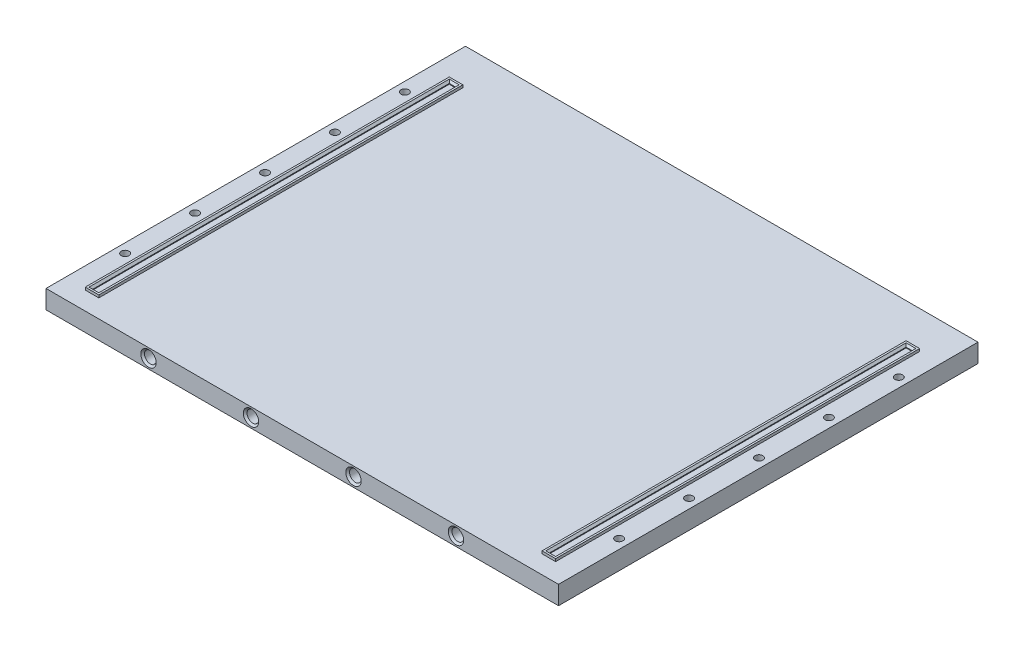
from build123d import *

# Parameters (mm, degrees)
SKETCH_1_W             = 138.06
SKETCH_1_H             = 113
EXTRUDE_301_DEPTH      = 5
SKETCH_2_W             = 3.65
SKETCH_2_H             = 98.05
SKETCH_2_W_2           = 1.65
SKETCH_2_H_2           = 96.05
EXTRUDE_2092_DEPTH     = 0.7
CHAMFER_2147_SIZE      = 0.5
CHAMFER_2335_SIZE      = 0.5
SKETCH_3_R             = 1.575
CUT_EXTRUDE_2766_DEPTH = 4.2
CUT_EXTRUDE_3301_REACH = 91.386
SKETCH_4_R             = 1.05
SKETCH_5_R             = 2
CUT_EXTRUDE_3811_DEPTH = 3
CHAMFER_3856_SIZE      = 0.5


with BuildPart() as part:
    # Эскиз1 → Extrude 301 (new body)
    with BuildSketch(Plane(origin=(0, 0, 0), x_dir=(1, 0, 0), z_dir=(0, 1, 0))):
        Rectangle(SKETCH_1_W, SKETCH_1_H)
    extrude(amount=EXTRUDE_301_DEPTH)

    # Эскиз2 → Extrude 2092 (add)
    # profile 1 of 2: a face of its own
    with BuildSketch(Plane(origin=(0, 5, 0), x_dir=(1, 0, 0), z_dir=(0, 1, 0))):
        with Locations((-61.525, -2.575)):
            Rectangle(SKETCH_2_W, SKETCH_2_H)
        with Locations((-61.525, -2.575)):
            Rectangle(SKETCH_2_W_2, SKETCH_2_H_2, mode=Mode.SUBTRACT)
    # profile 2 of 2: a face of its own
    with BuildSketch(Plane(origin=(0, 5, 0), x_dir=(1, 0, 0), z_dir=(0, 1, 0))):
        with Locations((61.525, -2.575)):
            Rectangle(SKETCH_2_W, SKETCH_2_H)
        with Locations((61.525, -2.575)):
            Rectangle(SKETCH_2_W_2, SKETCH_2_H_2, mode=Mode.SUBTRACT)
    extrude(amount=EXTRUDE_2092_DEPTH)

    # Chamfer 2147
    chamfer_2147_edges = [part.edges().sort_by_distance(p)[0] for p in [
        (-61.525, 5.7, -45.45),
        (-60.7, 5.7, 2.575),
        (-61.525, 5.7, 50.6),
        (-62.35, 5.7, 2.575),
    ]]
    chamfer(chamfer_2147_edges, length=CHAMFER_2147_SIZE)

    # Chamfer 2335
    chamfer_2335_edges = [part.edges().sort_by_distance(p)[0] for p in [
        (61.525, 5.7, 50.6),
        (60.7, 5.7, 2.575),
        (61.525, 5.7, -45.45),
        (62.35, 5.7, 2.575),
    ]]
    chamfer(chamfer_2335_edges, length=CHAMFER_2335_SIZE)

    # Эскиз3 → Cut-Extrude 2766 (cut)
    with BuildSketch(Plane(origin=(0, 0, -56.5), x_dir=(-1, 0, 0), z_dir=(0, 0, -1))):
        with Locations((-41.418, 2.5)):
            Circle(SKETCH_3_R)
        with Locations((-13.806, 2.5)):
            Circle(SKETCH_3_R)
        with Locations((13.806, 2.5)):
            Circle(SKETCH_3_R)
        with Locations((41.418, 2.5)):
            Circle(SKETCH_3_R)
    cut_extrude_2766 = extrude(amount=-CUT_EXTRUDE_2766_DEPTH, mode=Mode.SUBTRACT)

    # Зеркальное отражение1: Cut-Extrude 2766 across plane
    add(cut_extrude_2766.mirror(Plane(origin=(0, 0, 0), x_dir=(1, 0, 0), z_dir=(0, 0, -1))), mode=Mode.SUBTRACT)

    # Эскиз4 → Cut-Extrude 3301 (cut, up to next)
    with BuildSketch(Plane.XZ, mode=Mode.PRIVATE) as cut_extrude_3301_sk1:
        with Locations((-66.53, 37.666666667)):
            Circle(SKETCH_4_R)
    cut_extrude_3301_tool1 = extrude(cut_extrude_3301_sk1.sketch, amount=-CUT_EXTRUDE_3301_REACH, mode=Mode.PRIVATE) & part.part
    # Эскиз4 → Cut-Extrude 3301 (cut, up to next)
    with BuildSketch(Plane.XZ, mode=Mode.PRIVATE) as cut_extrude_3301_sk2:
        with Locations((-66.53, 18.833333333)):
            Circle(SKETCH_4_R)
    cut_extrude_3301_tool2 = extrude(cut_extrude_3301_sk2.sketch, amount=-CUT_EXTRUDE_3301_REACH, mode=Mode.PRIVATE) & part.part
    # Эскиз4 → Cut-Extrude 3301 (cut, up to next)
    with BuildSketch(Plane.XZ, mode=Mode.PRIVATE) as cut_extrude_3301_sk3:
        with Locations((-66.53, 0)):
            Circle(SKETCH_4_R)
    cut_extrude_3301_tool3 = extrude(cut_extrude_3301_sk3.sketch, amount=-CUT_EXTRUDE_3301_REACH, mode=Mode.PRIVATE) & part.part
    # Эскиз4 → Cut-Extrude 3301 (cut, up to next)
    with BuildSketch(Plane.XZ, mode=Mode.PRIVATE) as cut_extrude_3301_sk4:
        with Locations((-66.53, -18.833333333)):
            Circle(SKETCH_4_R)
    cut_extrude_3301_tool4 = extrude(cut_extrude_3301_sk4.sketch, amount=-CUT_EXTRUDE_3301_REACH, mode=Mode.PRIVATE) & part.part
    # Эскиз4 → Cut-Extrude 3301 (cut, up to next)
    with BuildSketch(Plane.XZ, mode=Mode.PRIVATE) as cut_extrude_3301_sk5:
        with Locations((-66.53, -37.666666667)):
            Circle(SKETCH_4_R)
    cut_extrude_3301_tool5 = extrude(cut_extrude_3301_sk5.sketch, amount=-CUT_EXTRUDE_3301_REACH, mode=Mode.PRIVATE) & part.part
    # Эскиз4 → Cut-Extrude 3301 (cut, up to next)
    with BuildSketch(Plane.XZ, mode=Mode.PRIVATE) as cut_extrude_3301_sk6:
        with Locations((66.53, -37.666666667)):
            Circle(SKETCH_4_R)
    cut_extrude_3301_tool6 = extrude(cut_extrude_3301_sk6.sketch, amount=-CUT_EXTRUDE_3301_REACH, mode=Mode.PRIVATE) & part.part
    # Эскиз4 → Cut-Extrude 3301 (cut, up to next)
    with BuildSketch(Plane.XZ, mode=Mode.PRIVATE) as cut_extrude_3301_sk7:
        with Locations((66.53, -18.833333333)):
            Circle(SKETCH_4_R)
    cut_extrude_3301_tool7 = extrude(cut_extrude_3301_sk7.sketch, amount=-CUT_EXTRUDE_3301_REACH, mode=Mode.PRIVATE) & part.part
    # Эскиз4 → Cut-Extrude 3301 (cut, up to next)
    with BuildSketch(Plane.XZ, mode=Mode.PRIVATE) as cut_extrude_3301_sk8:
        with Locations((66.53, 0)):
            Circle(SKETCH_4_R)
    cut_extrude_3301_tool8 = extrude(cut_extrude_3301_sk8.sketch, amount=-CUT_EXTRUDE_3301_REACH, mode=Mode.PRIVATE) & part.part
    # Эскиз4 → Cut-Extrude 3301 (cut, up to next)
    with BuildSketch(Plane.XZ, mode=Mode.PRIVATE) as cut_extrude_3301_sk9:
        with Locations((66.53, 18.833333333)):
            Circle(SKETCH_4_R)
    cut_extrude_3301_tool9 = extrude(cut_extrude_3301_sk9.sketch, amount=-CUT_EXTRUDE_3301_REACH, mode=Mode.PRIVATE) & part.part
    # Эскиз4 → Cut-Extrude 3301 (cut, up to next)
    with BuildSketch(Plane.XZ, mode=Mode.PRIVATE) as cut_extrude_3301_sk10:
        with Locations((66.53, 37.666666667)):
            Circle(SKETCH_4_R)
    cut_extrude_3301_tool10 = extrude(cut_extrude_3301_sk10.sketch, amount=-CUT_EXTRUDE_3301_REACH, mode=Mode.PRIVATE) & part.part
    add(cut_extrude_3301_tool1.solids().sort_by_distance((-66.53, 0, 37.666667))[0], mode=Mode.SUBTRACT)
    add(cut_extrude_3301_tool2.solids().sort_by_distance((-66.53, 0, 18.833333))[0], mode=Mode.SUBTRACT)
    add(cut_extrude_3301_tool3.solids().sort_by_distance((-66.53, 0, 0))[0], mode=Mode.SUBTRACT)
    add(cut_extrude_3301_tool4.solids().sort_by_distance((-66.53, 0, -18.833333))[0], mode=Mode.SUBTRACT)
    add(cut_extrude_3301_tool5.solids().sort_by_distance((-66.53, 0, -37.666667))[0], mode=Mode.SUBTRACT)
    add(cut_extrude_3301_tool6.solids().sort_by_distance((66.53, 0, -37.666667))[0], mode=Mode.SUBTRACT)
    add(cut_extrude_3301_tool7.solids().sort_by_distance((66.53, 0, -18.833333))[0], mode=Mode.SUBTRACT)
    add(cut_extrude_3301_tool8.solids().sort_by_distance((66.53, 0, 0))[0], mode=Mode.SUBTRACT)
    add(cut_extrude_3301_tool9.solids().sort_by_distance((66.53, 0, 18.833333))[0], mode=Mode.SUBTRACT)
    add(cut_extrude_3301_tool10.solids().sort_by_distance((66.53, 0, 37.666667))[0], mode=Mode.SUBTRACT)

    # Эскиз5 → Cut-Extrude 3811 (cut)
    with BuildSketch(Plane.XZ):
        with Locations((-66.53, 37.666666667)):
            Circle(SKETCH_5_R)
        with Locations((-66.53, 18.833333333)):
            Circle(SKETCH_5_R)
        with Locations((-66.53, 0)):
            Circle(SKETCH_5_R)
        with Locations((-66.53, -18.833333333)):
            Circle(SKETCH_5_R)
        with Locations((-66.53, -37.666666667)):
            Circle(SKETCH_5_R)
        with Locations((66.53, -37.666666667)):
            Circle(SKETCH_5_R)
        with Locations((66.53, -18.833333333)):
            Circle(SKETCH_5_R)
        with Locations((66.53, 0)):
            Circle(SKETCH_5_R)
        with Locations((66.53, 18.833333333)):
            Circle(SKETCH_5_R)
        with Locations((66.53, 37.666666667)):
            Circle(SKETCH_5_R)
    extrude(amount=-CUT_EXTRUDE_3811_DEPTH, mode=Mode.SUBTRACT)

    # Chamfer 3856
    chamfer_3856_edges = [part.edges().sort_by_distance(p)[0] for p in [
        (42.993, 2.5, 56.5),
        (15.381, 2.5, 56.5),
        (-12.231, 2.5, 56.5),
        (-39.843, 2.5, 56.5),
        (-39.843, 2.5, -56.5),
        (-12.231, 2.5, -56.5),
        (15.381, 2.5, -56.5),
        (42.993, 2.5, -56.5),
    ]]
    chamfer(chamfer_3856_edges, length=CHAMFER_3856_SIZE)


solid = part.part
